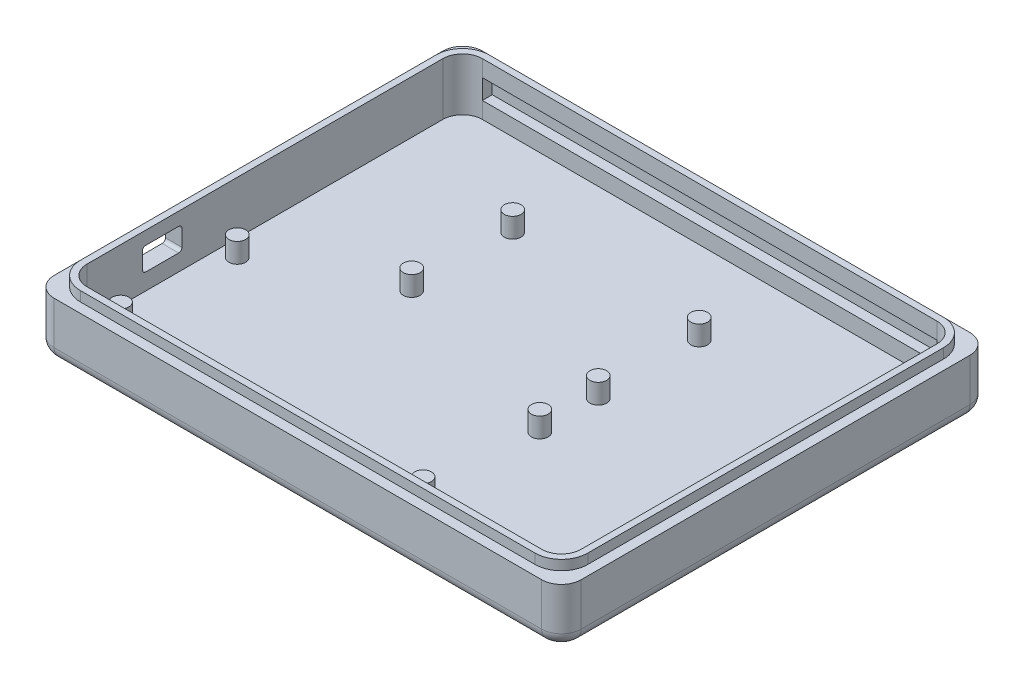
from build123d import *

# Parameters (mm, degrees)
SKETCH1_W           = 80
SKETCH1_H           = 65
BOSS_EXTRUDE1_DEPTH = 10
SKETCH2_W           = 75
SKETCH2_H           = 60
CUT_EXTRUDE1_DEPTH  = 8
FILLET4_R           = 2
FILLET5_R           = 3
SKETCH3_W           = 80
SKETCH3_H           = 65
SKETCH3_W_2         = 77
SKETCH3_H_2         = 62
CUT_EXTRUDE2_DEPTH  = 1.5
FILLET7_R           = 4
SKETCH4_R           = 1.27
BOSS_EXTRUDE2_DEPTH = 3
SKETCH5_W           = 6
SKETCH5_H           = 3.5
CUT_EXTRUDE3_DEPTH  = 102.642756751
FILLET8_R           = 0.5
SKETCH8_W           = 69
SKETCH8_H           = 3
CUT_EXTRUDE4_DEPTH  = 1.5
SKETCH9_W           = 69
SKETCH9_H           = 3
CUT_EXTRUDE5_DEPTH  = 1.5


with BuildPart() as part:
    # Sketch1 → Boss-Extrude1 (new body)
    with BuildSketch(Plane(origin=(0, 0, 0), x_dir=(1, 0, 0), z_dir=(0, 1, 0))):
        with Locations((40, 32.5)):
            Rectangle(SKETCH1_W, SKETCH1_H)
    extrude(amount=BOSS_EXTRUDE1_DEPTH)

    # Sketch2 → Cut-Extrude1 (cut)
    with BuildSketch(Plane(origin=(0, 10, 0), x_dir=(1, 0, 0), z_dir=(0, 1, 0))):
        with Locations((40, 32.5)):
            Rectangle(SKETCH2_W, SKETCH2_H)
    extrude(amount=-CUT_EXTRUDE1_DEPTH, mode=Mode.SUBTRACT)

    # Fillet4
    fillet4_edges = [part.edges().sort_by_distance(p)[0] for p in [
        (40, 0, -65),
        (80, 0, -32.5),
        (40, 0, 0),
        (0, 0, -32.5),
    ]]
    fillet(fillet4_edges, radius=FILLET4_R)

    # Fillet5
    # the kernel refuses this fillet: 3 mm, written as the material it adds along each edge
    with BuildSketch(Plane(origin=(2.5, 10, -2.5), x_dir=(0, 0, -1), z_dir=(0, -1, 0)), Plane(origin=(77.5, 10, -62.5), x_dir=(0, 0, 1), z_dir=(0, -1, 0)), Plane(origin=(77.5, 10, -2.5), x_dir=(-1, 0, 0), z_dir=(0, -1, 0))) as fillet5_piece_1:
        with BuildLine():
            CenterArc((FILLET5_R, FILLET5_R), FILLET5_R, 180, 90)
            Line((0, FILLET5_R), (0, 0))
            Line((0, 0), (FILLET5_R, 0))
        make_face()
    extrude(amount=8)
    with BuildSketch(Plane(origin=(2.5, 10, -62.5), x_dir=(0, 0, 1), z_dir=(0, -1, 0))) as fillet5_piece_2:
        with BuildLine():
            CenterArc((FILLET5_R, -FILLET5_R), FILLET5_R, 90, 90)
            Line((0, -FILLET5_R), (0, 0))
            Line((0, 0), (FILLET5_R, 0))
        make_face()
    extrude(amount=8)
    # the kernel refuses this fillet: 3 mm, written as the material it takes off along each edge
    with BuildSketch(Plane(origin=(77, 0, -62), x_dir=(0, 0, -1), z_dir=(-1, 0, 0))) as fillet5_2_piece_1:
        with BuildLine():
            CenterArc((1, -2), 2, 0, 90)
            Line((3, -2), (3, 0))
            Line((3, 0), (1, 0))
        make_face()
    revolve(axis=Axis((77, 0, -62), (0, -1, 0)), revolution_arc=90, mode=Mode.SUBTRACT)
    with BuildSketch(Plane(origin=(77, 0, -3), x_dir=(1, 0, 0), z_dir=(0, 0, -1))) as fillet5_2_piece_2:
        with BuildLine():
            CenterArc((1, -2), 2, 0, 90)
            Line((3, -2), (3, 0))
            Line((3, 0), (1, 0))
        make_face()
    revolve(axis=Axis((77, 0, -3), (0, -1, 0)), revolution_arc=90, mode=Mode.SUBTRACT)
    with BuildSketch(Plane(origin=(3, 0, -62), x_dir=(-1, 0, 0), z_dir=(0, 0, 1))) as fillet5_2_piece_3:
        with BuildLine():
            CenterArc((1, -2), 2, 0, 90)
            Line((3, -2), (3, 0))
            Line((3, 0), (1, 0))
        make_face()
    revolve(axis=Axis((3, 0, -62), (0, -1, 0)), revolution_arc=90, mode=Mode.SUBTRACT)
    with BuildSketch(Plane(origin=(3, 0, -3), x_dir=(0, 0, 1), z_dir=(1, 0, 0))) as fillet5_2_piece_4:
        with BuildLine():
            CenterArc((1, -2), 2, 0, 90)
            Line((3, -2), (3, 0))
            Line((3, 0), (1, 0))
        make_face()
    revolve(axis=Axis((3, 0, -3), (0, -1, 0)), revolution_arc=90, mode=Mode.SUBTRACT)
    with BuildSketch(Plane(origin=(0, 0, -65), x_dir=(0, 0, 1), z_dir=(0, 1, 0)), Plane(origin=(0, 0, 0), x_dir=(1, 0, 0), z_dir=(0, 1, 0))) as fillet5_2_piece_5:
        with BuildLine():
            CenterArc((FILLET5_R, FILLET5_R), FILLET5_R, 180, 90)
            Line((0, FILLET5_R), (0, 0))
            Line((0, 0), (FILLET5_R, 0))
        make_face()
    extrude(amount=17.5, mode=Mode.SUBTRACT)
    with BuildSketch(Plane(origin=(80, 0, -65), x_dir=(0, 0, 1), z_dir=(0, 1, 0)), Plane(origin=(80, 0, 0), x_dir=(-1, 0, 0), z_dir=(0, 1, 0))) as fillet5_2_piece_6:
        with BuildLine():
            CenterArc((FILLET5_R, -FILLET5_R), FILLET5_R, 90, 90)
            Line((0, -FILLET5_R), (0, 0))
            Line((0, 0), (FILLET5_R, 0))
        make_face()
    extrude(amount=17.5, mode=Mode.SUBTRACT)

    # Sketch3 → Cut-Extrude2 (cut)
    with BuildSketch(Plane(origin=(0, 10, 0), x_dir=(1, 0, 0), z_dir=(0, 1, 0))):
        with Locations((40, 32.5)):
            Rectangle(SKETCH3_W, SKETCH3_H)
        with Locations((40, 32.5)):
            Rectangle(SKETCH3_W_2, SKETCH3_H_2, mode=Mode.SUBTRACT)
    extrude(amount=-CUT_EXTRUDE2_DEPTH, mode=Mode.SUBTRACT)

    # Fillet7
    fillet7_edges = [part.edges().sort_by_distance(p)[0] for p in [
        (78.5, 9.25, -63.5),
        (78.5, 9.25, -1.5),
        (1.5, 9.25, -1.5),
        (1.5, 9.25, -63.5),
    ]]
    fillet(fillet7_edges, radius=FILLET7_R)

    # Sketch4 → Boss-Extrude2 (add)
    with BuildSketch(Plane(origin=(0, 2, 0), x_dir=(1, 0, 0), z_dir=(0, 1, 0))):
        with Locations(Location((5.04, 8.04, 0), (0, 0, 270))):
            Circle(SKETCH4_R)
        with Locations(Location((5.04, 25.76, 0), (0, 0, 270))):
            Circle(SKETCH4_R)
        with Locations(Location((22.64, 34.64, 0), (0, 0, 270))):
            Circle(SKETCH4_R)
        with Locations(Location((22.64, 49.96, 0), (0, 0, 270))):
            Circle(SKETCH4_R)
        with Locations(Location((50.96, 8.04, 0), (0, 0, 270))):
            Circle(SKETCH4_R)
        with Locations(Location((50.96, 25.76, 0), (0, 0, 270))):
            Circle(SKETCH4_R)
        with Locations(Location((50.96, 34.64, 0), (0, 0, 270))):
            Circle(SKETCH4_R)
        with Locations(Location((50.96, 49.96, 0), (0, 0, 270))):
            Circle(SKETCH4_R)
    extrude(amount=BOSS_EXTRUDE2_DEPTH)

    # Sketch5 → Cut-Extrude3 (cut, through all)
    with BuildSketch(Plane(origin=(2.5, 0, 0), x_dir=(0, 0, -1), z_dir=(1, 0, 0))):
        with Locations((16.9, 6.25)):
            Rectangle(SKETCH5_W, SKETCH5_H)
    extrude(amount=-CUT_EXTRUDE3_DEPTH, mode=Mode.SUBTRACT)

    # Fillet8
    fillet8_edges = [part.edges().sort_by_distance(p)[0] for p in [
        (1.25, 4.5, -19.9),
        (1.25, 4.5, -13.9),
        (1.25, 8, -13.9),
        (1.25, 8, -19.9),
    ]]
    fillet(fillet8_edges, radius=FILLET8_R)

    # Sketch8 → Cut-Extrude4 (cut)
    with BuildSketch(Plane.XY.offset(-62.5)):
        with Locations((40, 6)):
            Rectangle(SKETCH8_W, SKETCH8_H)
    extrude(amount=-CUT_EXTRUDE4_DEPTH, mode=Mode.SUBTRACT)

    # Sketch9 → Cut-Extrude5 (cut)
    with BuildSketch(Plane(origin=(0, 0, -2.5), x_dir=(-1, 0, 0), z_dir=(0, 0, -1))):
        with Locations((-40, 6)):
            Rectangle(SKETCH9_W, SKETCH9_H)
    extrude(amount=-CUT_EXTRUDE5_DEPTH, mode=Mode.SUBTRACT)


solid = part.part
